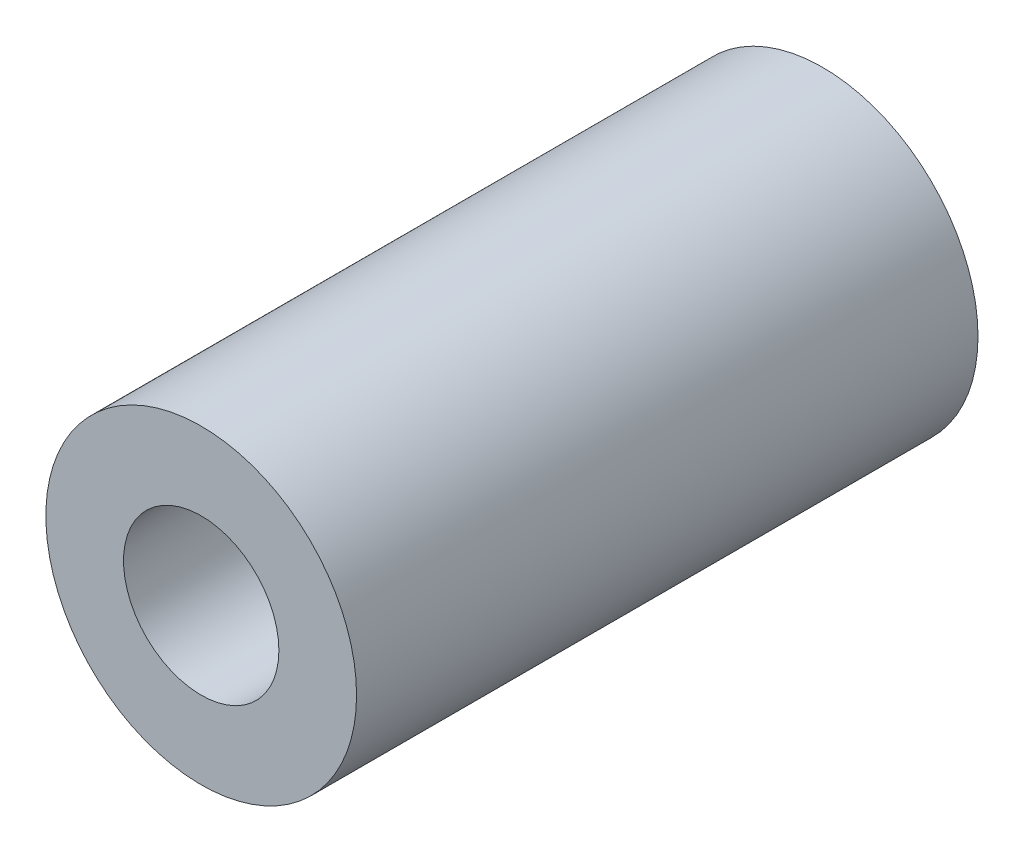
from build123d import *

# Parameters (mm, degrees)
BOSS_EXTRUDE1_DEPTH      = 12.7
BOSS_EXTRUDE1_DEPTH_BACK = 12.7
SKETCH1_R                = 6.35
SKETCH2_R                = 3.175
CUT_EXTRUDE1_DEPTH       = 27.940768363


with BuildPart() as part:
    # Sketch1 → Boss-Extrude1 (new, two sides: drawn at the far end of the back side and taken through both)
    with BuildSketch(Plane.XY.offset(-BOSS_EXTRUDE1_DEPTH_BACK)):
        Circle(SKETCH1_R)
    extrude(amount=BOSS_EXTRUDE1_DEPTH + BOSS_EXTRUDE1_DEPTH_BACK)

    # Sketch2 → Cut-Extrude1 (cut, through all)
    with BuildSketch(Plane.XY.offset(12.7)):
        Circle(SKETCH2_R)
    extrude(amount=-CUT_EXTRUDE1_DEPTH, mode=Mode.SUBTRACT)


solid = part.part
